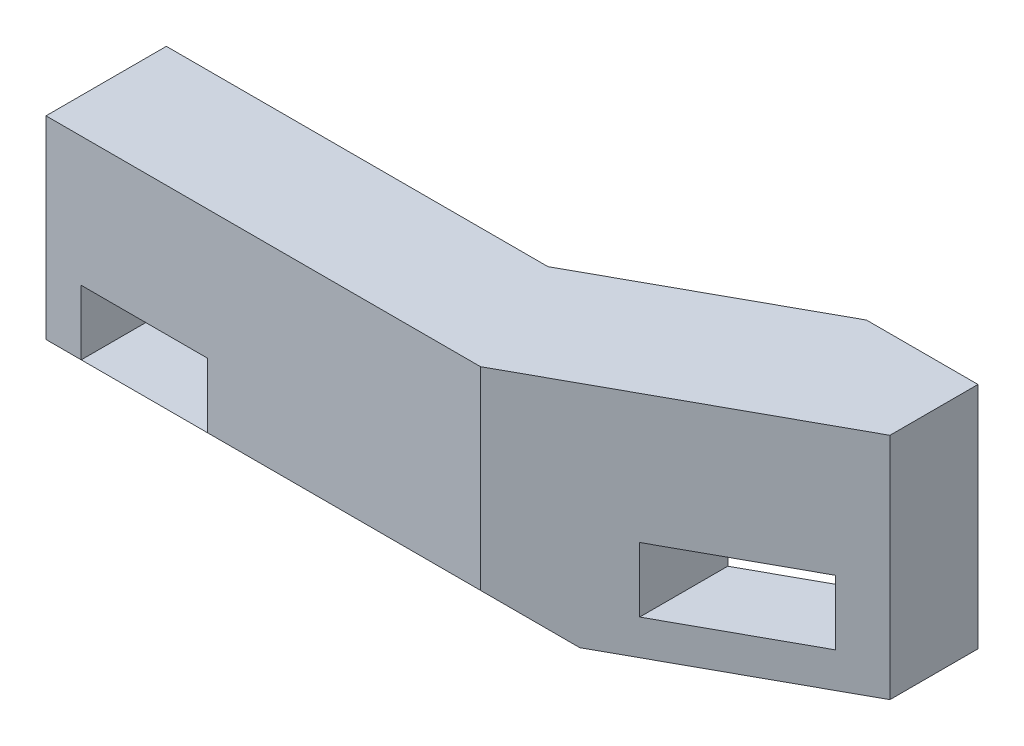
from build123d import *

# Parameters (mm, degrees)
SKETCH1_W               = 13
SKETCH1_H               = 4.1
BOSS_EXTRUDE1_DEPTH     = 3.9
CUT_EXTRUDE1_DEPTH      = 6.6
CUT_EXTRUDE2_DEPTH      = 20.434185635
CUT_EXTRUDE2_DEPTH_BACK = 20.434185635
SKETCH3_W               = 4.3
SKETCH3_H               = 2.2
CHAMFER1_SIZE           = 1.2


with BuildPart() as part:
    # Sketch1 → Boss-Extrude1 (new, symmetric)
    with BuildSketch(Plane(origin=(0, 0, 0), x_dir=(1, 0, 0), z_dir=(0, 1, 0))):
        Polygon((13.499620547, 5.899061033), (17.3, 5.899061033), (17.3, 2.899061033), (8.3, -2.05), (6.5, -2.05), (6.5, 2.05), align=None)
        Rectangle(SKETCH1_W, SKETCH1_H)
    extrude(amount=BOSS_EXTRUDE1_DEPTH, both=True)

    # Sketch2 → Cut-Extrude1 (cut)
    with BuildSketch(Plane.XZ.offset(3.9)):
        Polygon((17.3, -5.899061033), (8.3, -0.95), (6.5, -2.05), (13.499620547, -5.899061033), align=None)
    extrude(amount=-CUT_EXTRUDE1_DEPTH, mode=Mode.SUBTRACT)

    # Sketch3 → Cut-Extrude2 (cut, two sides: drawn at the far end of the back side and taken through both)
    with BuildSketch(Plane.XY.offset(2.05).offset(-CUT_EXTRUDE2_DEPTH_BACK)):
        with Locations((-3.15, -1.6)):
            Rectangle(SKETCH3_W, SKETCH3_H)
        with Locations((13.95, -1.6)):
            Rectangle(SKETCH3_W, SKETCH3_H)
    extrude(amount=CUT_EXTRUDE2_DEPTH + CUT_EXTRUDE2_DEPTH_BACK, mode=Mode.SUBTRACT)

    # Chamfer1
    chamfer1_edges = [part.edges().sort_by_distance(p)[0] for p in [
        (0.9, -3.9, 2.05),
    ]]
    chamfer(chamfer1_edges, length=CHAMFER1_SIZE - 0.0001)  # a hair under: the kernel refuses the full size


solid = part.part
